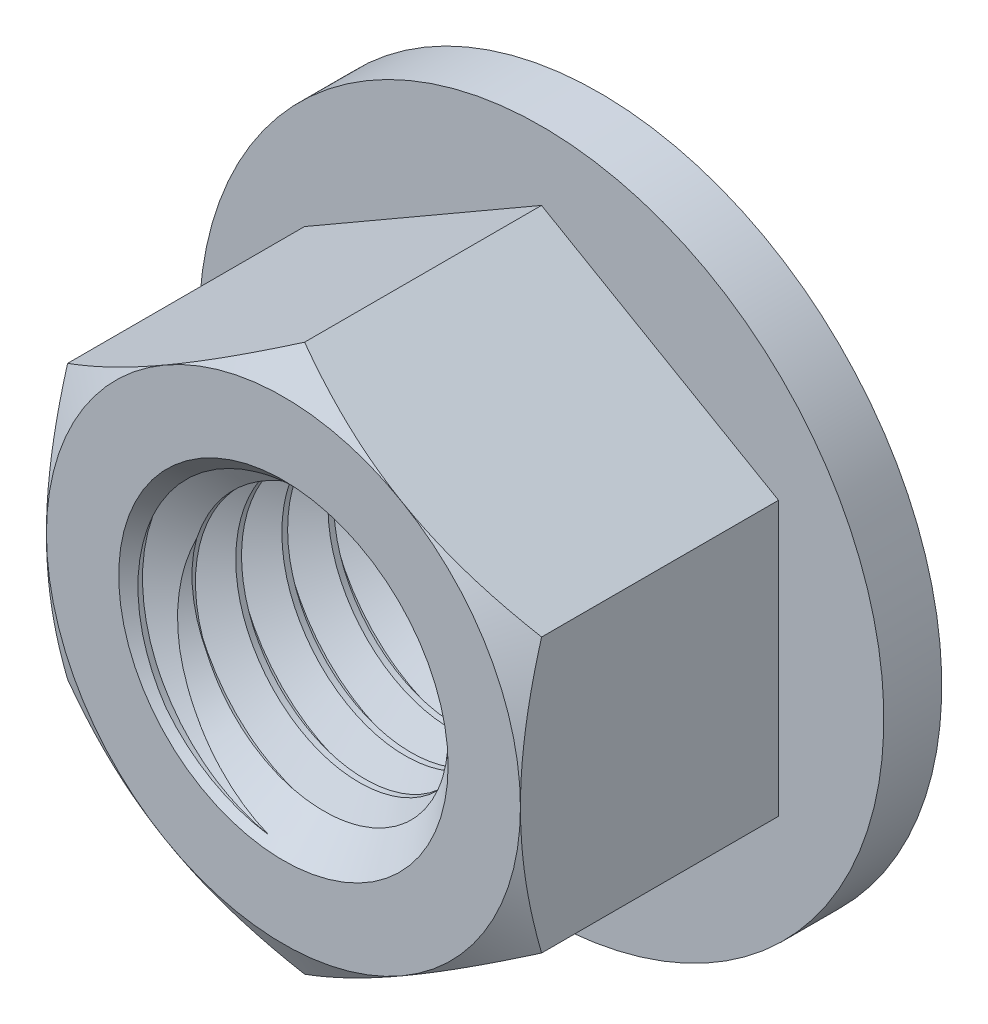
from build123d import *

# Parameters (mm, degrees)
EXTRUDE1_DEPTH     = 12
SKETCH13_R         = 13
EXTRUDE3_DEPTH     = 2.2
SKETCH2_OUTSIDE_W  = 115.252
SKETCH2_OUTSIDE_H  = 115.252
SKETCH2_OUTSIDE_R  = 9
CUT_EXTRUDE1_DEPTH = 22.9544984
CUT_EXTRUDE1_DRAFT = -60
SKETCH4_R          = 6
CUT_EXTRUDE3_DEPTH = 22.9544984
SKETCH12_R         = 6
SKETCH12_R_2       = 4.863341658
EXTRUDE2_DEPTH     = 12
CUT_SWEEP1_PITCH   = 1.75


with BuildPart() as part:
    # Sketch1 → Extrude1 (new body)
    with BuildSketch(Plane.XY):
        Polygon((0, 10.392304845), (-9, 5.196152423), (-9, -5.196152423), (0, -10.392304845), (9, -5.196152423), (9, 5.196152423), align=None)
    extrude(amount=-EXTRUDE1_DEPTH)

    # Sketch13 → Extrude3 (add)
    with BuildSketch(Plane(origin=(0, 0, -12), x_dir=(-1, 0, 0), z_dir=(0, 0, -1))):
        Circle(SKETCH13_R)
    extrude(amount=-EXTRUDE3_DEPTH)


with BuildPart() as cut_extrude1_tool:
    # Sketch2 outside → Cut-Extrude1 (with draft: the straight prism first)
    with BuildSketch(Plane.XY):
        Rectangle(SKETCH2_OUTSIDE_W, SKETCH2_OUTSIDE_H)
        Circle(SKETCH2_OUTSIDE_R, mode=Mode.SUBTRACT)
    extrude(amount=-CUT_EXTRUDE1_DEPTH)
    # Cut-Extrude1: the draft: its side faces are tilted about the plane it starts from
    cut_extrude1_sides = [cut_extrude1_tool.faces().sort_by_distance(p)[0] for p in [
        (0, -57.626, -11.4772492),
        (57.626, 0, -11.4772492),
        (0, 57.626, -11.4772492),
        (-57.626, 0, -11.4772492),
        (-9, 0, -11.4772492),
    ]]
    draft(cut_extrude1_sides, Plane.XY, CUT_EXTRUDE1_DRAFT)


with BuildPart() as part_1:
    add(part.part)

    # Cut-Extrude1: cut by cut_extrude1_tool
    add(cut_extrude1_tool.part, mode=Mode.SUBTRACT)

    # Sketch4 → Cut-Extrude3 (cut, through all)
    with BuildSketch(Plane.XY):
        Circle(SKETCH4_R)
    extrude(amount=-CUT_EXTRUDE3_DEPTH, mode=Mode.SUBTRACT)

    # Sketch12 → Extrude2 (add)
    with BuildSketch(Plane.XY):
        Circle(SKETCH12_R)
        Circle(SKETCH12_R_2, mode=Mode.SUBTRACT)
    extrude(amount=-EXTRUDE2_DEPTH)

    # Cut-Sweep1: the profile of Sketch9 profile screwed along a right-hand helix of 7.857143 turns, 6 arcs to a turn; built about Z, then put on its axis
    cut_sweep1_z = Axis((0, 0, 0), (0, 0, 1))
    cut_sweep1_corners = [(6, 0, -0.875), (6, 0, -0.65625), (4.863041658, 0, 0.000173205), (4.863041658, 0, -1.531423205)]
    with BuildLine(mode=Mode.PRIVATE) as cut_sweep1_profile:
        Line(cut_sweep1_corners[0], cut_sweep1_corners[1])
        Line(cut_sweep1_corners[1], cut_sweep1_corners[2])
        Line(cut_sweep1_corners[2], cut_sweep1_corners[3])
        Line(cut_sweep1_corners[3], cut_sweep1_corners[0])
    cut_sweep1_cap = Face(cut_sweep1_profile.wire())
    cut_sweep1_turn_angles = [0, 30, 60, 90, 120, 150, 180, 210, 240, 270, 300, 330, 360]
    cut_sweep1_turn_weights = [1, 0.8660254037844387, 1, 0.8660254037844387, 1, 0.8660254037844387, 1, 0.8660254037844387, 1, 0.8660254037844387, 1, 0.8660254037844387, 1]
    cut_sweep1_turn_rails = [Edge.make_bspline([Vector(p[0], p[1], 0).rotate(cut_sweep1_z, cut_sweep1_turn_angles[k]) / cut_sweep1_turn_weights[k] + Vector(0, 0, p[2] + CUT_SWEEP1_PITCH * cut_sweep1_turn_angles[k] / 360) for k in range(13)], [0, 0, 0, 1, 1, 2, 2, 3, 3, 4, 4, 5, 5, 6, 6, 6], 2, cut_sweep1_turn_weights) for p in cut_sweep1_corners]
    cut_sweep1_turn_sides = [Face.make_surface_from_curves(cut_sweep1_turn_rails[p[0]], cut_sweep1_turn_rails[p[1]]) for p in [(0, 1), (1, 2), (2, 3), (3, 0)]]
    cut_sweep1_last_angles = [2520, 2550, 2580, 2610, 2640, 2670, 2700, 2730, 2760, 2790, 2820, 2824.285714286, 2828.571428571]
    cut_sweep1_last_weights = [1, 0.8660254037844387, 1, 0.8660254037844387, 1, 0.8660254037844387, 1, 0.8660254037844387, 1, 0.8660254037844387, 1, 0.9972037971811675, 1]
    cut_sweep1_last_rails = [Edge.make_bspline([Vector(p[0], p[1], 0).rotate(cut_sweep1_z, cut_sweep1_last_angles[k]) / cut_sweep1_last_weights[k] + Vector(0, 0, p[2] + CUT_SWEEP1_PITCH * cut_sweep1_last_angles[k] / 360) for k in range(13)], [0, 0, 0, 1, 1, 2, 2, 3, 3, 4, 4, 5, 5, 6, 6, 6], 2, cut_sweep1_last_weights) for p in cut_sweep1_corners]
    cut_sweep1_last_sides = [Face.make_surface_from_curves(cut_sweep1_last_rails[p[0]], cut_sweep1_last_rails[p[1]]) for p in [(0, 1), (1, 2), (2, 3), (3, 0)]]
    cut_sweep1 = Plane(origin=(0, 0, 0), x_dir=(0, 1, 0), z_dir=(0, 0, -1)) * Solid(Shell([*[p.moved(Location((0, 0, CUT_SWEEP1_PITCH * i))) for i in range(7) for p in cut_sweep1_turn_sides], *cut_sweep1_last_sides, cut_sweep1_cap, cut_sweep1_cap.rotate(cut_sweep1_z, 2828.571428571).moved(Location((0, 0, CUT_SWEEP1_PITCH * 2828.571428571 / 360)))]))
    add(cut_sweep1, mode=Mode.SUBTRACT)

    # Cut-Extrude6 cone 1 section (through the dimple's axis) → Cut-Extrude6 (revolve, cut)
    with BuildSketch(Plane(origin=(0, 0, 0), x_dir=(0, -1, 0), z_dir=(1, 0, 0))):
        Polygon((0, 0), (6.254, 0), (0, 6.254), align=None)
    revolve(axis=Axis((0, 0, 0), (0, 0, -1)), mode=Mode.SUBTRACT)

    # Cut-Extrude7 cone 1 section (through the dimple's axis) → Cut-Extrude7 (revolve, cut)
    with BuildSketch(Plane(origin=(0, 0, -12), x_dir=(0, 1, 0), z_dir=(1, 0, 0))):
        Polygon((0, 0), (6.254, 0), (0, 6.254), align=None)
    revolve(axis=Axis((0, 0, -12), (0, 0, 1)), mode=Mode.SUBTRACT)


solid = part_1.part
